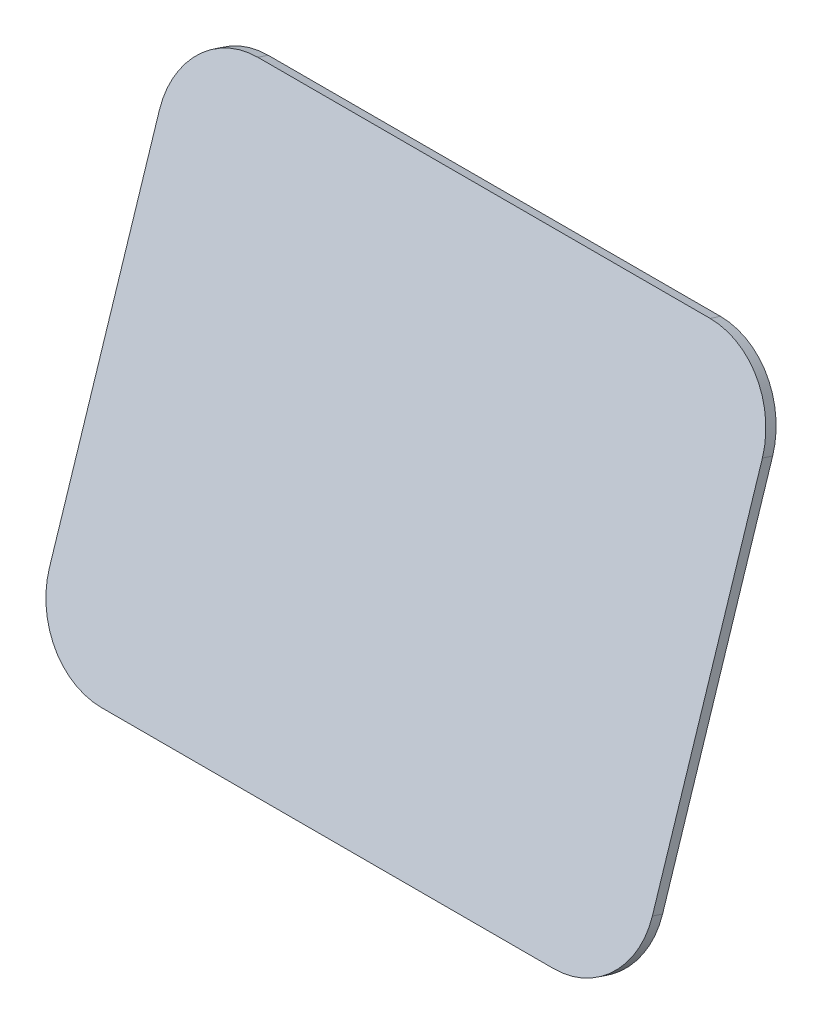
from build123d import *

# Parameters (mm, degrees)
BOSS_EXTRUDE1_DEPTH = 3


with BuildPart() as part:
    # Sketch1 → Boss-Extrude1 (new body)
    with BuildSketch(Plane(origin=(0, 68.253852605, 211.886836303), x_dir=(1, 0, 0), z_dir=(0, 0.30660913934042044, 0.9518355087266532))):
        with BuildLine():
            Line((84, 109.872559187), (84, 9.872559187))
            ThreePointArc((84, 9.872559187), (77.849242405, -4.976683218), (63, -11.127440813))
            Line((63, -11.127440813), (-63, -11.127440813))
            ThreePointArc((-63, -11.127440813), (-77.849242405, -4.976683218), (-84, 9.872559187))
            Line((-84, 9.872559187), (-84, 109.872559187))
            ThreePointArc((-84, 109.872559187), (-77.849242405, 124.721801592), (-63, 130.872559187))
            Line((-63, 130.872559187), (63, 130.872559187))
            ThreePointArc((63, 130.872559187), (77.849242405, 124.721801592), (84, 109.872559187))
        make_face()
    extrude(amount=BOSS_EXTRUDE1_DEPTH)


solid = part.part
